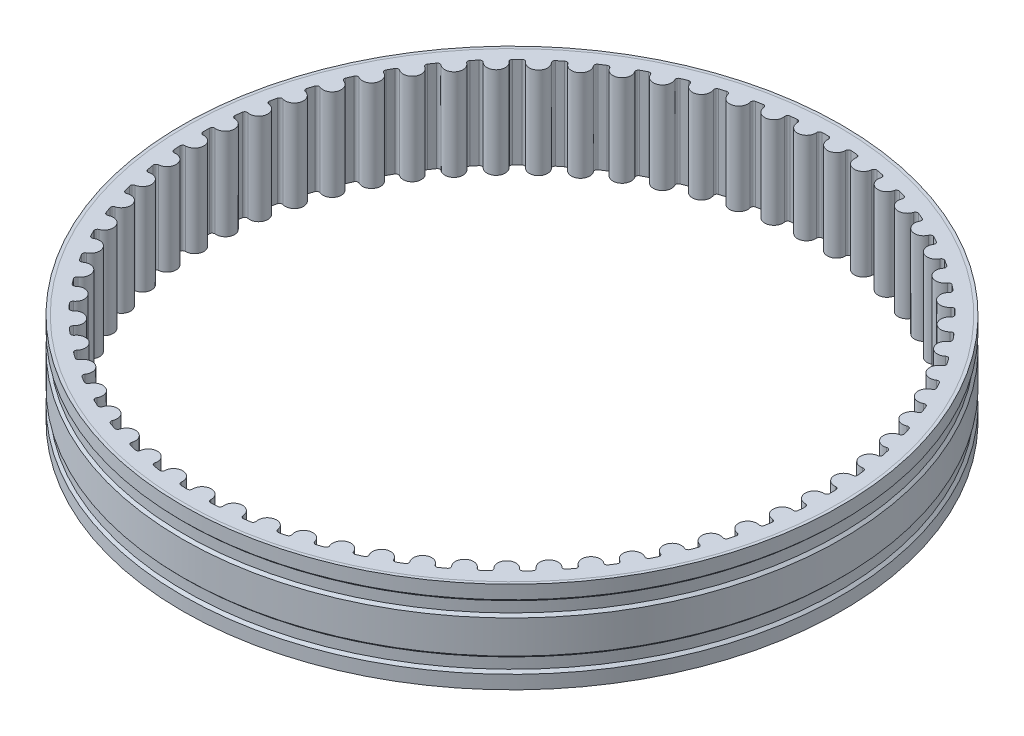
from build123d import *

# Parameters (mm, degrees)
CUT_EXTRUDE1_DEPTH = 77.798770299
CIRPATTERN1_COUNT  = 65


with BuildPart() as part:
    # Sketch2 → Revolve1 (revolve)
    with BuildSketch(Plane(origin=(0, 0, 0), x_dir=(0, 0, -1), z_dir=(1, 0, 0))):
        Polygon((49.325356505, 7.5), (49.325356505, -7.5), (53.545356505, -7.5), (53.545356505, -5.5), (53.125356505, -5.08), (53.125356505, -2.92), (53.545356505, -2.5), (53.545356505, 2.5), (53.125356505, 2.92), (53.125356505, 5.08), (53.545356505, 5.5), (53.545356505, 7.5), align=None)
    revolve(axis=Axis((0, 0, 0), (0, 1, 0)))

    # Sketch3 → Cut-Extrude1 (cut, symmetric)
    with BuildSketch(Plane(origin=(0, 0, 0), x_dir=(1, 0, 0), z_dir=(0, 1, 0))):
        with BuildLine():
            ThreePointArc((1.944049187, -51.348568976), (2.222057168, -51.33728981), (2.5, -51.324505484))
            Line((2.5, -51.324505484), (2.5, -49.261960927))
            ThreePointArc((2.5, -49.261960927), (0, -49.325356505), (-2.5, -49.261960927))
            Line((-2.5, -49.261960927), (-2.5, -51.324505484))
            ThreePointArc((-2.5, -51.324505484), (-2.222057168, -51.33728981), (-1.944049187, -51.348568976))
            ThreePointArc((-1.944049187, -51.348568976), (-1.622191384, -51.221391153), (-1.498275471, -50.898263485))
            ThreePointArc((-1.498275471, -50.898263485), (0, -49.326356505), (1.498275471, -50.898263485))
            ThreePointArc((1.498275471, -50.898263485), (1.622191384, -51.221391153), (1.944049187, -51.348568976))
        make_face()
    cut_extrude1 = extrude(amount=CUT_EXTRUDE1_DEPTH, both=True, mode=Mode.SUBTRACT)

    # CirPattern1: Cut-Extrude1 ×65 about axis
    cirpattern1_axis = Axis((0, 0, 0), (0, 1, 0))
    for i in range(1, CIRPATTERN1_COUNT):
        add(cut_extrude1.rotate(cirpattern1_axis, i * 360 / CIRPATTERN1_COUNT), mode=Mode.SUBTRACT)


with BuildPart() as body_2:
    # Sketch2<3> → Revolve2 (revolve)
    with BuildSketch(Plane(origin=(0, 0, 0), x_dir=(0, 0, -1), z_dir=(1, 0, 0))):
        Polygon((53.545356505, 5.5), (53.125356505, 5.08), (53.125356505, 2.92), (53.545356505, 2.5), (53.545356505, -2.5), (53.125356505, -2.92), (53.125356505, -5.08), (53.545356505, -5.5), (53.545356505, -7.5), (54.045356505, -7.5), (54.045356505, -5.292893219), (53.625356505, -4.872893219), (53.625356505, -3.127106781), (54.045356505, -2.707106781), (54.045356505, 2.707106781), (53.625356505, 3.127106781), (53.625356505, 4.872893219), (54.045356505, 5.292893219), (54.045356505, 7.5), (53.545356505, 7.5), align=None)
    revolve(axis=Axis((0, 0, 0), (0, 1, 0)))


solid = Compound([part.part, body_2.part])
